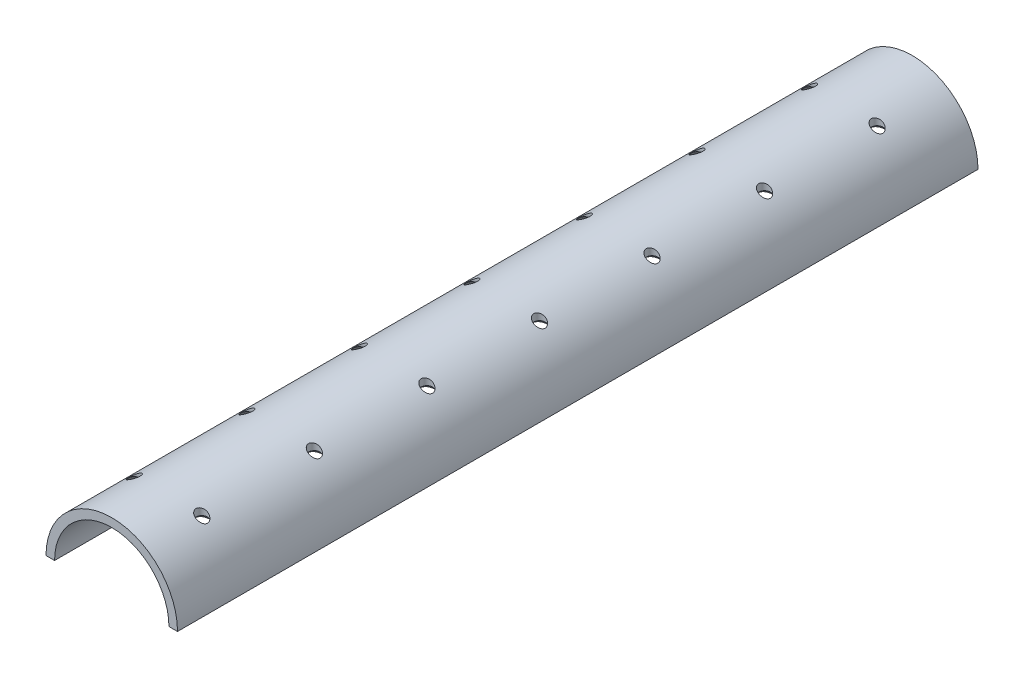
from build123d import *

# Parameters (mm, degrees)
SKETCH2_R                                    = 29.21
BOSS_EXTRUDE1_DEPTH                          = 355.6
SKETCH3_R                                    = 25.4
CUT_EXTRUDE1_DEPTH                           = 358.99135213
CUT_EXTRUDE2_REACH                           = 359.991
SKETCH4_W                                    = 58.42
SKETCH4_H                                    = 355.6
CSK_FOR_10_FLAT_HEAD_MACHINE_SCREW1_AT_COUNT = 2
CSK_FOR_10_FLAT_HEAD_MACHINE_SCREW1_AT_PITCH = 50
CSK_FOR_10_FLAT_HEAD_MACHINE_SCREW1_2_COUNT  = 2
CSK_FOR_10_FLAT_HEAD_MACHINE_SCREW1_2_PITCH  = 30
CSK_FOR_10_FLAT_HEAD_MACHINE_SCREW1_3_COUNT  = 2
CSK_FOR_10_FLAT_HEAD_MACHINE_SCREW1_3_PITCH  = 58.309518948
CSK_FOR_10_FLAT_HEAD_MACHINE_SCREW1_4_COUNT  = 2
CSK_FOR_10_FLAT_HEAD_MACHINE_SCREW1_4_PITCH  = 100
CSK_FOR_10_FLAT_HEAD_MACHINE_SCREW1_5_COUNT  = 2
CSK_FOR_10_FLAT_HEAD_MACHINE_SCREW1_5_PITCH  = 104.403065089
CSK_FOR_10_FLAT_HEAD_MACHINE_SCREW1_6_COUNT  = 2
CSK_FOR_10_FLAT_HEAD_MACHINE_SCREW1_6_PITCH  = 152.970585408
CSK_FOR_10_FLAT_HEAD_MACHINE_SCREW1_7_COUNT  = 2
CSK_FOR_10_FLAT_HEAD_MACHINE_SCREW1_7_PITCH  = 150
CSK_FOR_10_FLAT_HEAD_MACHINE_SCREW1_8_COUNT  = 2
CSK_FOR_10_FLAT_HEAD_MACHINE_SCREW1_8_PITCH  = 200
CSK_FOR_10_FLAT_HEAD_MACHINE_SCREW1_9_COUNT  = 2
CSK_FOR_10_FLAT_HEAD_MACHINE_SCREW1_9_PITCH  = 202.237484162
CSK_FOR_10_FLAT_HEAD_MACHINE_SCREW1_10_COUNT = 2
CSK_FOR_10_FLAT_HEAD_MACHINE_SCREW1_10_PITCH = 251.79356624
CSK_FOR_10_FLAT_HEAD_MACHINE_SCREW1_11_COUNT = 2
CSK_FOR_10_FLAT_HEAD_MACHINE_SCREW1_11_PITCH = 250
CSK_FOR_10_FLAT_HEAD_MACHINE_SCREW1_12_COUNT = 2
CSK_FOR_10_FLAT_HEAD_MACHINE_SCREW1_12_PITCH = 300
CSK_FOR_10_FLAT_HEAD_MACHINE_SCREW1_13_COUNT = 2
CSK_FOR_10_FLAT_HEAD_MACHINE_SCREW1_13_PITCH = 301.496268634


with BuildPart() as part:
    # Sketch2 → Boss-Extrude1 (new body)
    with BuildSketch(Plane.XY):
        Circle(SKETCH2_R)
    extrude(amount=-BOSS_EXTRUDE1_DEPTH)

    # Sketch3 → Cut-Extrude1 (cut, through all)
    with BuildSketch(Plane.XY):
        Circle(SKETCH3_R)
    extrude(amount=-CUT_EXTRUDE1_DEPTH, mode=Mode.SUBTRACT)

    # Sketch4 → Cut-Extrude2 (cut, up to next)
    with BuildSketch(Plane(origin=(0, 0, 0), x_dir=(1, 0, 0), z_dir=(0, 1, 0)), mode=Mode.PRIVATE) as cut_extrude2_sk1:
        with Locations((0, 177.8)):
            Rectangle(SKETCH4_W, SKETCH4_H)
    cut_extrude2_tool1 = extrude(cut_extrude2_sk1.sketch, amount=-CUT_EXTRUDE2_REACH, mode=Mode.PRIVATE) & part.part
    add(cut_extrude2_tool1.solids().sort_by_distance((0, 0, -177.8))[0], mode=Mode.SUBTRACT)

    # Sketch10 → CSK for #10 Flat Head Machine Screw1 (revolve, cut)
    with BuildSketch(Plane(origin=(15, 0, -25), x_dir=(0, 0, -1), z_dir=(1, 0, 0))):
        Polygon((0, 0), (0, 29.21), (2.5527, 29.21), (2.5527, 23.188180894), (4.8895, 20.5), (4.8895, 0), align=None)
    csk_for_10_flat_head_machine_screw1 = revolve(axis=Axis((15, -6.35, -25), (0, 1, 0)), mode=Mode.SUBTRACT)

    # CSK for #10 Flat Head Machine Screw1 at: CSK for #10 Flat Head Machine Screw1 ×2
    with Locations(*[(0, 0, -i * CSK_FOR_10_FLAT_HEAD_MACHINE_SCREW1_AT_PITCH) for i in range(1, CSK_FOR_10_FLAT_HEAD_MACHINE_SCREW1_AT_COUNT)]):
        add(csk_for_10_flat_head_machine_screw1, mode=Mode.SUBTRACT)

    # CSK for _10 Flat Head Machine Screw1 2: CSK for #10 Flat Head Machine Screw1 ×2
    with Locations(*[(-i * CSK_FOR_10_FLAT_HEAD_MACHINE_SCREW1_2_PITCH, 0, 0) for i in range(1, CSK_FOR_10_FLAT_HEAD_MACHINE_SCREW1_2_COUNT)]):
        add(csk_for_10_flat_head_machine_screw1, mode=Mode.SUBTRACT)

    # CSK for _10 Flat Head Machine Screw1 3: CSK for #10 Flat Head Machine Screw1 ×2
    with Locations(*[Vector(-0.5144957554275265, 0, -0.8574929257125443) * (i * CSK_FOR_10_FLAT_HEAD_MACHINE_SCREW1_3_PITCH) for i in range(1, CSK_FOR_10_FLAT_HEAD_MACHINE_SCREW1_3_COUNT)]):
        add(csk_for_10_flat_head_machine_screw1, mode=Mode.SUBTRACT)

    # CSK for _10 Flat Head Machine Screw1 4: CSK for #10 Flat Head Machine Screw1 ×2
    with Locations(*[(0, 0, -i * CSK_FOR_10_FLAT_HEAD_MACHINE_SCREW1_4_PITCH) for i in range(1, CSK_FOR_10_FLAT_HEAD_MACHINE_SCREW1_4_COUNT)]):
        add(csk_for_10_flat_head_machine_screw1, mode=Mode.SUBTRACT)

    # CSK for _10 Flat Head Machine Screw1 5: CSK for #10 Flat Head Machine Screw1 ×2
    with Locations(*[Vector(-0.2873478855663454, 0, -0.9578262852211514) * (i * CSK_FOR_10_FLAT_HEAD_MACHINE_SCREW1_5_PITCH) for i in range(1, CSK_FOR_10_FLAT_HEAD_MACHINE_SCREW1_5_COUNT)]):
        add(csk_for_10_flat_head_machine_screw1, mode=Mode.SUBTRACT)

    # CSK for _10 Flat Head Machine Screw1 6: CSK for #10 Flat Head Machine Screw1 ×2
    with Locations(*[Vector(-0.196116135138184, 0, -0.9805806756909202) * (i * CSK_FOR_10_FLAT_HEAD_MACHINE_SCREW1_6_PITCH) for i in range(1, CSK_FOR_10_FLAT_HEAD_MACHINE_SCREW1_6_COUNT)]):
        add(csk_for_10_flat_head_machine_screw1, mode=Mode.SUBTRACT)

    # CSK for _10 Flat Head Machine Screw1 7: CSK for #10 Flat Head Machine Screw1 ×2
    with Locations(*[(0, 0, -i * CSK_FOR_10_FLAT_HEAD_MACHINE_SCREW1_7_PITCH) for i in range(1, CSK_FOR_10_FLAT_HEAD_MACHINE_SCREW1_7_COUNT)]):
        add(csk_for_10_flat_head_machine_screw1, mode=Mode.SUBTRACT)

    # CSK for _10 Flat Head Machine Screw1 8: CSK for #10 Flat Head Machine Screw1 ×2
    with Locations(*[(0, 0, -i * CSK_FOR_10_FLAT_HEAD_MACHINE_SCREW1_8_PITCH) for i in range(1, CSK_FOR_10_FLAT_HEAD_MACHINE_SCREW1_8_COUNT)]):
        add(csk_for_10_flat_head_machine_screw1, mode=Mode.SUBTRACT)

    # CSK for _10 Flat Head Machine Screw1 9: CSK for #10 Flat Head Machine Screw1 ×2
    with Locations(*[Vector(-0.14834045293024462, 0, -0.9889363528682976) * (i * CSK_FOR_10_FLAT_HEAD_MACHINE_SCREW1_9_PITCH) for i in range(1, CSK_FOR_10_FLAT_HEAD_MACHINE_SCREW1_9_COUNT)]):
        add(csk_for_10_flat_head_machine_screw1, mode=Mode.SUBTRACT)

    # CSK for _10 Flat Head Machine Screw1 10: CSK for #10 Flat Head Machine Screw1 ×2
    with Locations(*[Vector(-0.11914522061843062, 0, -0.9928768384869221) * (i * CSK_FOR_10_FLAT_HEAD_MACHINE_SCREW1_10_PITCH) for i in range(1, CSK_FOR_10_FLAT_HEAD_MACHINE_SCREW1_10_COUNT)]):
        add(csk_for_10_flat_head_machine_screw1, mode=Mode.SUBTRACT)

    # CSK for _10 Flat Head Machine Screw1 11: CSK for #10 Flat Head Machine Screw1 ×2
    with Locations(*[(0, 0, -i * CSK_FOR_10_FLAT_HEAD_MACHINE_SCREW1_11_PITCH) for i in range(1, CSK_FOR_10_FLAT_HEAD_MACHINE_SCREW1_11_COUNT)]):
        add(csk_for_10_flat_head_machine_screw1, mode=Mode.SUBTRACT)

    # CSK for _10 Flat Head Machine Screw1 12: CSK for #10 Flat Head Machine Screw1 ×2
    with Locations(*[(0, 0, -i * CSK_FOR_10_FLAT_HEAD_MACHINE_SCREW1_12_PITCH) for i in range(1, CSK_FOR_10_FLAT_HEAD_MACHINE_SCREW1_12_COUNT)]):
        add(csk_for_10_flat_head_machine_screw1, mode=Mode.SUBTRACT)

    # CSK for _10 Flat Head Machine Screw1 13: CSK for #10 Flat Head Machine Screw1 ×2
    with Locations(*[Vector(-0.09950371902099887, 0, -0.9950371902099892) * (i * CSK_FOR_10_FLAT_HEAD_MACHINE_SCREW1_13_PITCH) for i in range(1, CSK_FOR_10_FLAT_HEAD_MACHINE_SCREW1_13_COUNT)]):
        add(csk_for_10_flat_head_machine_screw1, mode=Mode.SUBTRACT)


solid = part.part
